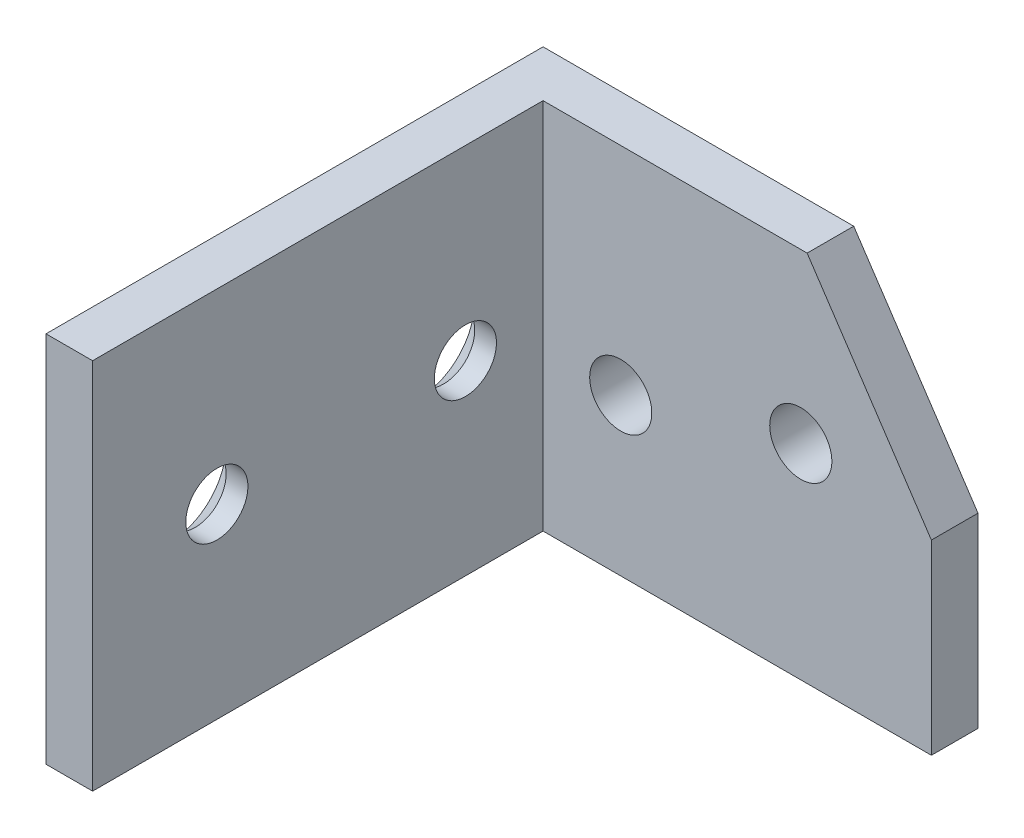
from build123d import *

# Parameters (mm, degrees)
BOSS_EXTRUDE1_DEPTH     = 38.1
SKETCH2_R               = 3.175
CUT_EXTRUDE1_DEPTH      = 38.1
CUT_EXTRUDE3_REACH      = 79.512
SKETCH3_R               = 3.175
CHAMFER1_SIZE           = 2.54
CUT_EXTRUDE4_DEPTH      = 75.882225236
CUT_EXTRUDE4_DEPTH_BACK = 75.882225236


with BuildPart() as part:
    # Sketch1 → Boss-Extrude1 (new body)
    with BuildSketch(Plane(origin=(0, 0, 0), x_dir=(1, 0, 0), z_dir=(0, 1, 0))):
        Polygon((0, 0), (0, 46.0375), (39.6875, 46.0375), (39.6875, 50.8), (-4.7625, 50.8), (-4.7625, 0), align=None)
    extrude(amount=BOSS_EXTRUDE1_DEPTH)

    # Sketch2 → Cut-Extrude1 (cut)
    with BuildSketch(Plane(origin=(0, 0, -50.8), x_dir=(-1, 0, 0), z_dir=(0, 0, -1))):
        with Locations((-26.338386991, 20.92691832)):
            Circle(SKETCH2_R)
        with Locations((-7.9375, 15.996415511)):
            Circle(SKETCH2_R)
    extrude(amount=-CUT_EXTRUDE1_DEPTH, mode=Mode.SUBTRACT)

    # Sketch3 → Cut-Extrude3 (cut, up to next)
    with BuildSketch(Plane.ZY.offset(4.7625), mode=Mode.PRIVATE) as cut_extrude3_sk1:
        with Locations((-12.7, 19.05)):
            Circle(SKETCH3_R)
    cut_extrude3_tool1 = extrude(cut_extrude3_sk1.sketch, amount=-CUT_EXTRUDE3_REACH, mode=Mode.PRIVATE) & part.part
    # Sketch3 → Cut-Extrude3 (cut, up to next)
    with BuildSketch(Plane.ZY.offset(4.7625), mode=Mode.PRIVATE) as cut_extrude3_sk2:
        with Locations((-38.1, 19.05)):
            Circle(SKETCH3_R)
    cut_extrude3_tool2 = extrude(cut_extrude3_sk2.sketch, amount=-CUT_EXTRUDE3_REACH, mode=Mode.PRIVATE) & part.part
    add(cut_extrude3_tool1.solids().sort_by_distance((-4.7625, 19.05, -12.7))[0], mode=Mode.SUBTRACT)
    add(cut_extrude3_tool2.solids().sort_by_distance((-4.7625, 19.05, -38.1))[0], mode=Mode.SUBTRACT)

    # Chamfer1
    chamfer1_edges = [part.edges().sort_by_distance(p)[0] for p in [
        (-4.7625, 19.05, -15.875),
        (-4.7625, 19.05, -41.275),
    ]]
    chamfer(chamfer1_edges, length=CHAMFER1_SIZE)

    # Sketch4 → Cut-Extrude4 (cut, two sides: drawn at the far end of the back side and taken through both)
    with BuildSketch(Plane(origin=(0, 0, -50.8), x_dir=(-1, 0, 0), z_dir=(0, 0, -1)).offset(-CUT_EXTRUDE4_DEPTH_BACK)):
        Polygon((33.580309215, 128.951713823), (-26.9875, 38.1), (-39.6875, 19.05), (-100.255309215, -71.801713823), (-281.958736861, 49.333904608), (-148.12311843, 250.087332253), align=None)
    extrude(amount=CUT_EXTRUDE4_DEPTH + CUT_EXTRUDE4_DEPTH_BACK, mode=Mode.SUBTRACT)


solid = part.part
